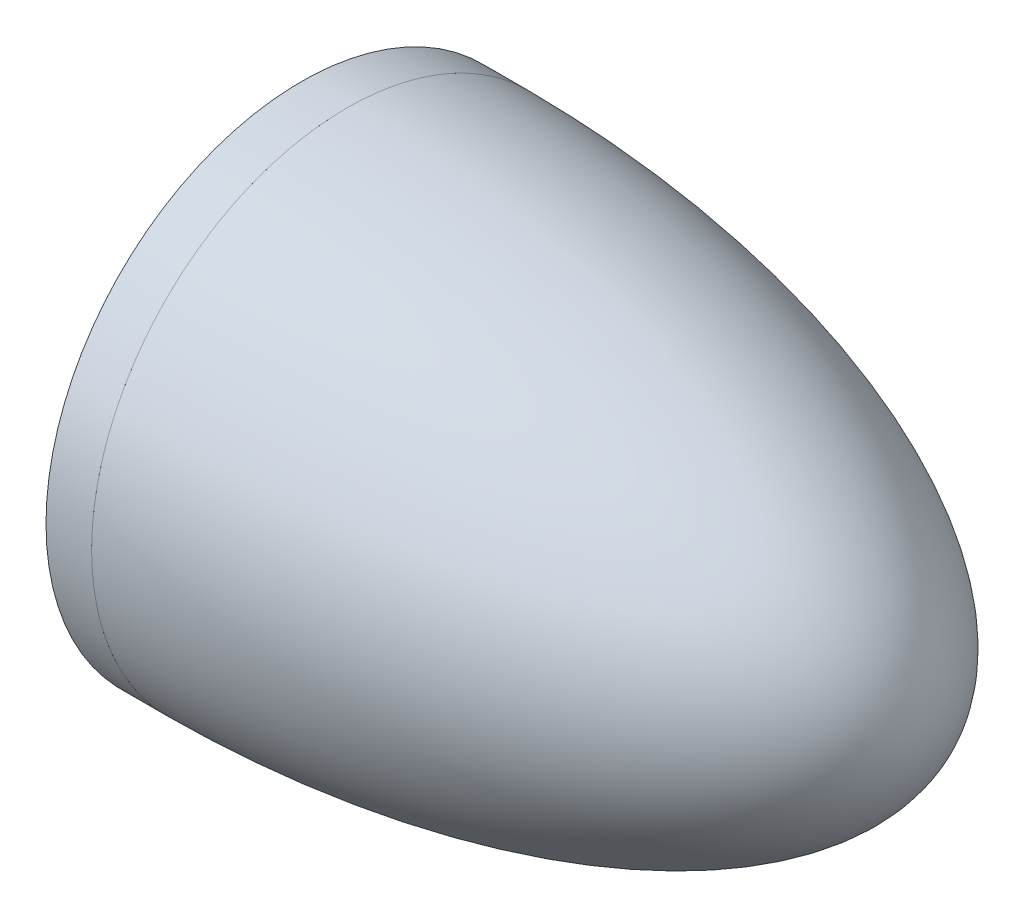
from build123d import *

# Parameters (mm, degrees)
SKETCH6_R           = 27.94
BOSS_EXTRUDE6_DEPTH = 5
SKETCH7_W           = 2.51
SKETCH7_H           = 2.51
CUT_EXTRUDE2_DEPTH  = 4


with BuildPart() as part:
    # Sketch5 → Revolve1 (revolve)
    with BuildSketch(Plane.XY):
        with BuildLine():
            Line((-0.328961319, 27.94), (0, 0))
            Line((0, 0), (63.171038681, 0))
            add(Edge.make_bspline(
                [(-0.328961319, 27.94), (-0.05395675, 27.94), (0.502062694, 27.938354329), (1.510654901, 27.930948795), (2.629776384, 27.911192975), (3.862685789, 27.88153976), (5.03363434, 27.841965786), (6.239014157, 27.792439642), (7.424042602, 27.732921987), (8.619806989, 27.663365114), (9.808800043, 27.583713197), (11.29782825, 27.471448509), (13.081093774, 27.316264965), (15.159932329, 27.105009742), (17.530388542, 26.821336162), (19.895627835, 26.49444213), (22.843780164, 26.030350227), (26.366382261, 25.381942524), (29.865201335, 24.613218598), (33.332390518, 23.713522874), (36.767725583, 22.700470759), (40.165988358, 21.567350749), (43.983040934, 20.08449517), (47.691796007, 18.34618465), (50.749720306, 16.647184877), (53.186653456, 15.07517208), (55.114506288, 13.664163103), (56.834920404, 12.213543688), (58.299775753, 10.777349526), (59.5178523, 9.382245543), (60.480157134, 8.092800697), (61.251847104, 6.865575832), (61.874509034, 5.667559663), (62.377519716, 4.469847359), (62.762354198, 3.267661905), (63.038705948, 1.993816908), (63.14691281, 0.994961874), (63.171033754, 0.339314847), (63.171038681, 0)],
                knots=[0.078506899, 0.078506899, 0.078506899, 0.078506899, 0.078506899, 0.093260601, 0.108014303, 0.122768005, 0.137521707, 0.152275408, 0.16702911, 0.181782812, 0.196536513, 0.211290215, 0.226043917, 0.255551321, 0.285058724, 0.314566127, 0.344073532, 0.373580937, 0.432595738, 0.491610543, 0.521117947, 0.55062535, 0.609640138, 0.668654928, 0.723427074, 0.752934408, 0.782441812, 0.811949069, 0.841456691, 0.864083497, 0.883754481, 0.903425142, 0.920918388, 0.93566904, 0.95042951, 0.96757906, 0.98322914, 1, 1, 1, 1, 1], degree=4))
        make_face()
    revolve(axis=Axis((0, 0, 0), (1, 0, 0)))

    # Sketch6 → Boss-Extrude6 (add)
    with BuildSketch(Plane(origin=(0, 0, 0), x_dir=(0, 0, -1), z_dir=(1, 0, 0))):
        Circle(SKETCH6_R)
    extrude(amount=-BOSS_EXTRUDE6_DEPTH)

    # Sketch7 → Cut-Extrude2 (cut)
    with BuildSketch(Plane.ZY.offset(5)):
        with Locations((0.015, 0.015)):
            Rectangle(SKETCH7_W, SKETCH7_H)
    extrude(amount=-CUT_EXTRUDE2_DEPTH, mode=Mode.SUBTRACT)


solid = part.part
